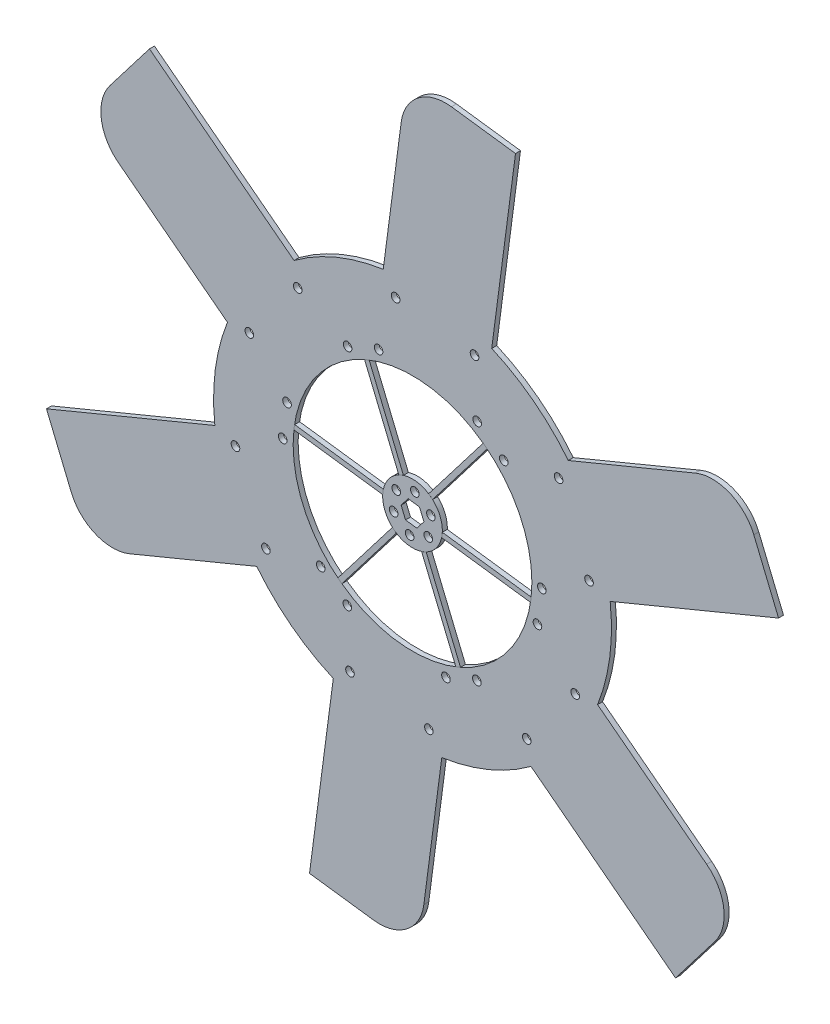
from build123d import *

# Parameters (mm, degrees)
SKETCH1_R            = 127
BOSS_EXTRUDE1_DEPTH  = 3.175
M5_CLEARANCE_HOLE1_D = 5.5
CIRPATTERN1_COUNT    = 6
BOSS_EXTRUDE2_DEPTH  = 3.175
CIRPATTERN2_COUNT    = 6
CUT_EXTRUDE1_REACH   = 335.168
SKETCH7_R            = 76.2
SKETCH7_R_2          = 19.05
BOSS_EXTRUDE8_DEPTH  = 3.175
CIRPATTERN4_COUNT    = 6
CUT_EXTRUDE2_DEPTH   = 334.167593846


# Read off the part's stored shape, not the designer's step: Boss-Extrude8
with BuildPart() as part:
    # Sketch1 → Boss-Extrude1 (new body)
    with BuildSketch(Plane.XY):
        Circle(SKETCH1_R)
    extrude(amount=BOSS_EXTRUDE1_DEPTH)

    # M5 Clearance Hole1 (through all)
    with Locations(Plane(origin=(0, 0, 0), x_dir=(-1, 0, 0), z_dir=(0, 0, -1))):
        with Locations((-58.2494214, 58.493652703), (-82.549819355, -0.172697611), (-93.238867767, 66.113565457), (-112.679186132, 19.180485205), (-11.733270063, 4.860079591)):
            m5_clearance_hole1 = Hole(M5_CLEARANCE_HOLE1_D / 2)

    # CirPattern1: M5 Clearance Hole1 ×6 about axis
    cirpattern1_axis = Axis((-0.168463788, -0.069779986, 0), (0, 0, 1))
    for i in range(1, CIRPATTERN1_COUNT):
        add(m5_clearance_hole1.rotate(cirpattern1_axis, i * 360 / CIRPATTERN1_COUNT), mode=Mode.SUBTRACT)

    # Sketch6 → Boss-Extrude2 (add)
    with BuildSketch(Plane(origin=(0, 0, 0), x_dir=(-1, 0, 0), z_dir=(0, 0, -1))):
        with BuildLine():
            Line((-92.527543442, 76.128710982), (-180.527068914, 112.579307915))
            ThreePointArc((-180.527068914, 112.579307915), (-202.397427074, 112.579307915), (-217.862105635, 97.114629353))
            Line((-217.862105635, 97.114629353), (-233.657364306, 58.981501649))
            Line((-233.657364306, 58.981501649), (-119.257981193, 11.595725636))
            Line((-119.257981193, 11.595725636), (-92.527543442, 76.128710982))
        make_face()
    boss_extrude2 = extrude(amount=-BOSS_EXTRUDE2_DEPTH)

    # CirPattern2: Boss-Extrude2 ×6 about axis
    cirpattern2_axis = Axis((0, 0, 0), (0, 0, 1))
    for i in range(1, CIRPATTERN2_COUNT):
        add(boss_extrude2.rotate(cirpattern2_axis, i * 360 / CIRPATTERN2_COUNT))

    # Sketch7 → Cut-Extrude1 (cut, up to next)
    with BuildSketch(Plane.XY, mode=Mode.PRIVATE) as cut_extrude1_sk1:
        Circle(SKETCH7_R)
        Circle(SKETCH7_R_2, mode=Mode.SUBTRACT)
    cut_extrude1_tool1 = extrude(cut_extrude1_sk1.sketch, amount=CUT_EXTRUDE1_REACH, mode=Mode.PRIVATE) & part.part
    add(cut_extrude1_tool1.solids().sort_by_distance((-74.044739, 0, 0))[0], mode=Mode.SUBTRACT)


with BuildPart() as cut_extrude1_piece_1:
    # of the separate pieces the step leaves, piece 1, a body of its own (cut_extrude1_pieces)
    add(part.part.solids().sort_by_distance((99.443628683, 78.993447287, 0))[0])


with BuildPart() as cut_extrude1_piece_2:
    # of the separate pieces the step leaves, piece 2, a body of its own (cut_extrude1_pieces)
    add(part.part.solids().sort_by_distance((19.05, 0, 0))[0])

    # Sketch16 → Cut-Extrude2 (cut, through all)
    with BuildSketch(Plane.XY.offset(3.175)):
        Polygon((2.80596826, -6.774206629), (7.269619162, -0.957063519), (4.463650901, 5.81714311), (-2.80596826, 6.774206629), (-7.269619162, 0.957063519), (-4.463650901, -5.81714311), align=None)
    extrude(amount=-CUT_EXTRUDE2_DEPTH, mode=Mode.SUBTRACT)


with BuildPart() as body_3:
    # Boss-Extrude8 outline → Boss-Extrude8 (new body)
    with BuildSketch(Plane.XY):
        with BuildLine():
            Line((-30.620807389, 69.776831075), (-8.731421131, 16.931177899))
            ThreePointArc((-8.731421131, 16.931177899), (-7.290119387, 17.599905094), (-5.798103615, 18.146197797))
            Line((-5.798103615, 18.146197797), (-27.687489873, 70.991850973))
            ThreePointArc((-27.687489873, 70.991850973), (-29.160477546, 70.399620377), (-30.620807389, 69.776831075))
        make_face()
    extrude(amount=BOSS_EXTRUDE8_DEPTH)


with BuildPart() as cirpattern4_1:
    # CirPattern4: pattern copy
    add(body_3.part.rotate(Axis((0, 0, 0), (0, 0, 1)), 1 * 360 / CIRPATTERN4_COUNT))


with BuildPart() as cirpattern4_2:
    # CirPattern4: pattern copy
    add(body_3.part.rotate(Axis((0, 0, 0), (0, 0, 1)), 2 * 360 / CIRPATTERN4_COUNT))


with BuildPart() as cirpattern4_3:
    # CirPattern4: pattern copy
    add(body_3.part.rotate(Axis((0, 0, 0), (0, 0, 1)), 3 * 360 / CIRPATTERN4_COUNT))


with BuildPart() as cirpattern4_4:
    # CirPattern4: pattern copy
    add(body_3.part.rotate(Axis((0, 0, 0), (0, 0, 1)), 4 * 360 / CIRPATTERN4_COUNT))


with BuildPart() as cirpattern4_5:
    # CirPattern4: pattern copy
    add(body_3.part.rotate(Axis((0, 0, 0), (0, 0, 1)), 5 * 360 / CIRPATTERN4_COUNT))


solid = Compound([cut_extrude1_piece_1.part, cut_extrude1_piece_2.part, body_3.part, cirpattern4_1.part, cirpattern4_2.part, cirpattern4_3.part, cirpattern4_4.part, cirpattern4_5.part])
